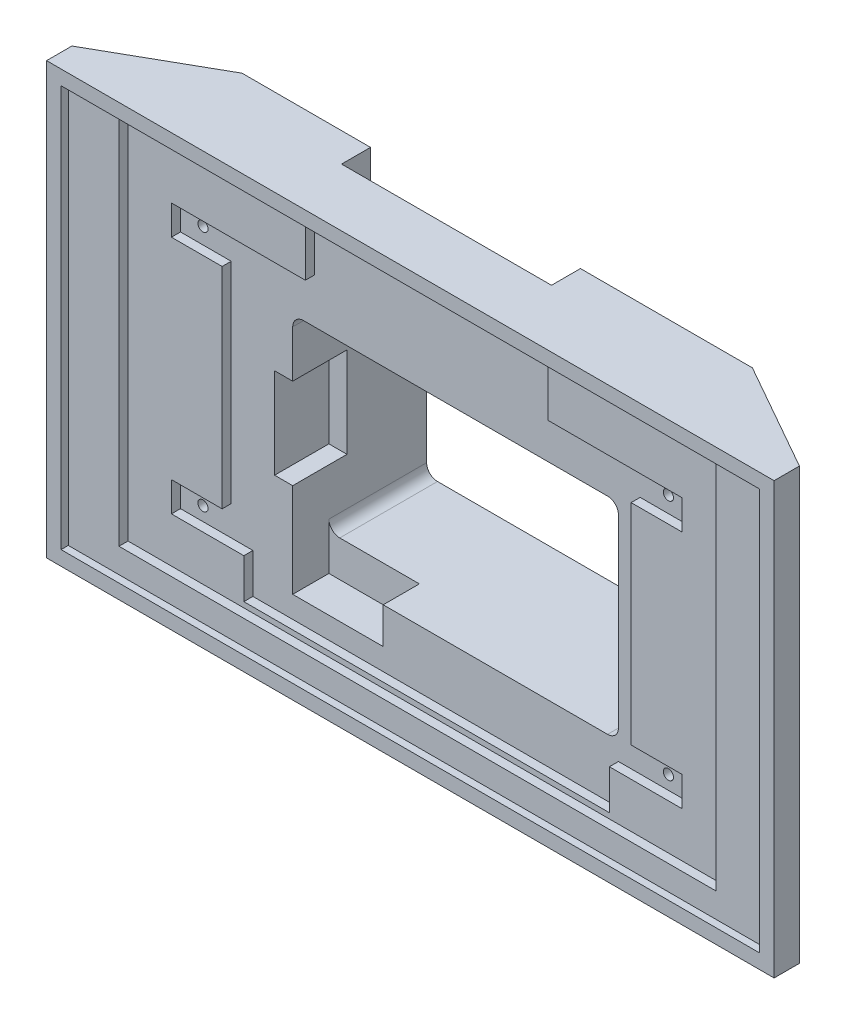
from build123d import *

# Parameters (mm, degrees)
SKETCH_1_W               = 201
SKETCH_1_H               = 119
SKETCH_1_W_2             = 193
SKETCH_1_H_2             = 111
EXTRUDE_1_DEPTH          = 7
SKETCH_2_W               = 193
SKETCH_2_H               = 111
SKETCH_2_W_2             = 165
SKETCH_2_H_2             = 103
EXTRUDE_2_DEPTH          = 5
EXTRUDE_3_DEPTH          = 2.5
LOFT_START               = -59.5
LOFT_1_DEPTH             = 119
LOFT_START_2             = -62
LOFT_1_2_OUTLINE_W       = 204
LOFT_1_2_OUTLINE_H       = 20
LOFT_1_2_DEPTH           = 3.262509478
SKETCH_6_W               = 90
SKETCH_6_H               = 57
CUT_EXTRUDE_1_DEPTH      = 119.023302788
SKETCH_7_W               = 100
SKETCH_7_H               = 67
SKETCH_7_W_2             = 90
SKETCH_7_H_2             = 57
EXTRUDE_4_DEPTH          = 20
CUT_EXTRUDE_2_DEPTH      = 123.513264592
CUT_EXTRUDE_2_DEPTH_BACK = 123.513264592
SKETCH_8_R               = 1.4
CHAMFER_1_SIZE           = 1.6
CHAMFER_1_SIZE2          = 1.2
SKETCH_9_W               = 25
SKETCH_9_H               = 10
CUT_EXTRUDE_3_DEPTH      = 10
SKETCH_11_W              = 5
SKETCH_11_H              = 25
CUT_EXTRUDE_4_DEPTH      = 15
SKETCH_12_W              = 16.5
SKETCH_12_H              = 16
SKETCH_12_W_2            = 15
SKETCH_12_H_2            = 18
CUT_EXTRUDE_5_DEPTH      = 25
SKETCH_13_R              = 3.5
SKETCH_13_W              = 10.5
SKETCH_13_H              = 4
SKETCH_13_W_2            = 8
CUT_EXTRUDE_6_DEPTH      = 137.913622409
SKETCH_14_W              = 58
SKETCH_14_H              = 8
CUT_EXTRUDE_7_DEPTH      = 28.7
SKETCH_16_W              = 16.5
SKETCH_16_H              = 2.9
EXTRUDE_5_DEPTH          = 1
FILLET_1_R               = 3
SKETCH_17_R              = 1.4
CUT_EXTRUDE_8_DEPTH      = 15


with BuildPart() as part:
    # 스케치1 → 보스-돌출1 (new body)
    with BuildSketch(Plane.XY):
        Rectangle(SKETCH_1_W, SKETCH_1_H)
        Rectangle(SKETCH_1_W_2, SKETCH_1_H_2, mode=Mode.SUBTRACT)
    extrude(amount=EXTRUDE_1_DEPTH)

    # 스케치2 → 보스-돌출2 (add)
    with BuildSketch(Plane.XY):
        Rectangle(SKETCH_2_W, SKETCH_2_H)
        with Locations((0, 2.8)):
            Rectangle(SKETCH_2_W_2, SKETCH_2_H_2, mode=Mode.SUBTRACT)
    extrude(amount=EXTRUDE_2_DEPTH)

    # 스케치3 → 보스-돌출3 (add)
    with BuildSketch(Plane.XY):
        Polygon((100.5, 59.5), (23.488425816, 59.5), (-23.488425816, 59.5), (-100.5, 59.5), (-100.5, -59.5), (-40.50450245, -59.5), (40.50450245, -59.5), (100.5, -59.5), align=None)
        Polygon((33.5, 54.3), (33.5, 38.2), (70.5, 38.2), (70.5, 30), (56.5, 30), (56.5, -28), (70.5, -28), (70.5, -36.2), (50.5, -36.2), (50.5, -47.2), (-50.5, -47.2), (-50.5, -36.2), (-70.5, -36.2), (-70.5, -28), (-56.5, -28), (-56.5, 30), (-70.5, 30), (-70.5, 38.2), (-33.5, 38.2), (-33.5, 54.3), align=None, mode=Mode.SUBTRACT)
    extrude(amount=EXTRUDE_3_DEPTH)

    # 로프트1: read off the stored shape, not the designer's step
    # 로프트1 outline → 로프트1 (add)
    with BuildSketch(Plane(origin=(0, 0, 0), x_dir=(1, 0, 0), z_dir=(0, 1, 0)).offset(LOFT_START)):
        Polygon((-100.5, 0), (100.5, 0), (70.5, 17), (-70.5, 17), align=None)
    extrude(amount=LOFT_1_DEPTH)

    # Loft 1 2 outline → Loft 1 2 (cut)
    with BuildSketch(Plane(origin=(0, 0, 0), x_dir=(1, 0, 0), z_dir=(0, 0.987184714663186, 0.15958176316661)).offset(LOFT_START_2)):
        with Locations((0, -1)):
            Rectangle(LOFT_1_2_OUTLINE_W, LOFT_1_2_OUTLINE_H)
    extrude(amount=LOFT_1_2_DEPTH, mode=Mode.SUBTRACT)

    # 스케치6 → 컷-돌출1 (cut, through all)
    with BuildSketch(Plane.XY):
        with Locations((5.5, -2.7)):
            Rectangle(SKETCH_6_W, SKETCH_6_H)
    extrude(amount=-CUT_EXTRUDE_1_DEPTH, mode=Mode.SUBTRACT)

    # 스케치7 → 보스-돌출4 (add)
    with BuildSketch(Plane(origin=(0, 0, -17), x_dir=(-1, 0, 0), z_dir=(0, 0, -1))):
        with Locations((-5.5, -2.7)):
            Rectangle(SKETCH_7_W, SKETCH_7_H)
        with Locations((-5.5, -2.7)):
            Rectangle(SKETCH_7_W_2, SKETCH_7_H_2, mode=Mode.SUBTRACT)
    extrude(amount=EXTRUDE_4_DEPTH)

    # 스케치8 → 컷-돌출2 (cut, two sides: drawn at the far end of the back side and taken through both)
    with BuildSketch(Plane.XY.offset(-CUT_EXTRUDE_2_DEPTH_BACK)):
        with Locations(Location((-64.298517718, 34.495358942, 0), (0, 0, 180))):
            Circle(SKETCH_8_R)
        with Locations(Location((-64.298517718, -32.379184814, 0), (0, 0, 180))):
            Circle(SKETCH_8_R)
        with Locations(Location((64.298517718, -32.379184814, 0), (0, 0, 180))):
            Circle(SKETCH_8_R)
        with Locations(Location((64.298517718, 34.495358942, 0), (0, 0, 180))):
            Circle(SKETCH_8_R)
    extrude(amount=CUT_EXTRUDE_2_DEPTH + CUT_EXTRUDE_2_DEPTH_BACK, mode=Mode.SUBTRACT)

    # 모따기1
    chamfer_1_edges = [part.edges().sort_by_distance(p)[0] for p in [
        (65.698517718, 34.495358942, -17),
        (65.698517718, -32.379184814, -17),
        (-62.898517718, -32.379184814, -17),
        (-62.898517718, 34.495358942, -17),
    ]]
    chamfer_1_side = [part.faces().sort_by_distance(p)[0] for p in [
        (0, -54.924448604, -17),
    ]]
    chamfer(chamfer_1_edges, length=CHAMFER_1_SIZE, length2=CHAMFER_1_SIZE2, reference=chamfer_1_side[0])

    # 스케치9 → 컷-돌출3 (cut)
    with BuildSketch(Plane.XY):
        with Locations((-27, -36.2)):
            Rectangle(SKETCH_9_W, SKETCH_9_H)
    extrude(amount=-CUT_EXTRUDE_3_DEPTH, mode=Mode.SUBTRACT)

    # 스케치11 → 컷-돌출4 (cut)
    with BuildSketch(Plane.XY):
        with Locations((-42, -2.7)):
            Rectangle(SKETCH_11_W, SKETCH_11_H)
    extrude(amount=-CUT_EXTRUDE_4_DEPTH, mode=Mode.SUBTRACT)

    # 스케치12 → 컷-돌출5 (cut)
    with BuildSketch(Plane.ZY.offset(-50.5)):
        with Locations((-22.75, 15.000577725)):
            Rectangle(SKETCH_12_W, SKETCH_12_H)
        with Locations((-22.75, -2.499422275)):
            Rectangle(SKETCH_12_W, SKETCH_12_H)
        with Locations((-22, -20.999422275)):
            Rectangle(SKETCH_12_W_2, SKETCH_12_H_2)
    extrude(amount=-CUT_EXTRUDE_5_DEPTH, mode=Mode.SUBTRACT)

    # 스케치13 → 컷-돌출6 (cut, through all)
    with BuildSketch(Plane.XZ.offset(-25.8)):
        with Locations(Location((16.152845052, -14.5, 0), (0, 0, 270))):
            Circle(SKETCH_13_R)
        with Locations((-27.097154948, -13)):
            Rectangle(SKETCH_13_W, SKETCH_13_H)
        with Locations((-11.847154948, -13)):
            Rectangle(SKETCH_13_W_2, SKETCH_13_H)
        with Locations((2.152845052, -13)):
            Rectangle(SKETCH_13_W_2, SKETCH_13_H)
    extrude(amount=-CUT_EXTRUDE_6_DEPTH, mode=Mode.SUBTRACT)

    # 스케치14 → 컷-돌출7 (cut)
    with BuildSketch(Plane(origin=(0, 59.5, 0), x_dir=(1, 0, 0), z_dir=(0, 1, 0))):
        with Locations((-6, 13)):
            Rectangle(SKETCH_14_W, SKETCH_14_H)
    extrude(amount=-CUT_EXTRUDE_7_DEPTH, mode=Mode.SUBTRACT)

    # 스케치16 → 보스-돌출5 (add)
    with BuildSketch(Plane(origin=(55.5, 0, 0), x_dir=(0, 0, -1), z_dir=(1, 0, 0))):
        with Locations((22.75, 6.250577725)):
            Rectangle(SKETCH_16_W, SKETCH_16_H)
        with Locations((22.75, -11.249422275)):
            Rectangle(SKETCH_16_W, SKETCH_16_H)
    extrude(amount=-EXTRUDE_5_DEPTH)

    # 필렛1
    # the kernel refuses this fillet: 3 mm, written as the material it adds along each edge
    with BuildSketch(Plane(origin=(50.5, -31.2, 0), x_dir=(0, 1, 0), z_dir=(0, 0, -1))) as fillet_1_piece_1_section:
        with BuildLine():
            CenterArc((FILLET_1_R, -FILLET_1_R), FILLET_1_R, 90, 90)
            Line((0, -FILLET_1_R), (0, 0))
            Line((0, 0), (FILLET_1_R, 0))
        make_face()
    fillet_1_piece_1 = extrude(amount=37, mode=Mode.PRIVATE)
    fillet_1_piece_1 = split(fillet_1_piece_1, bisect_by=Plane(origin=(50.5, -29.999422275, 0), z_dir=(0, 1, 0)), keep=Keep.TOP, mode=Mode.PRIVATE)
    fillet_1_piece_1 = split(fillet_1_piece_1, bisect_by=Plane(origin=(50.5, -31.2, -14.5), z_dir=(0, 0, 1)), keep=Keep.TOP, mode=Mode.PRIVATE)
    add(fillet_1_piece_1)
    with BuildSketch(Plane(origin=(50.5, -31.2, 0), x_dir=(0, 1, 0), z_dir=(0, 0, -1))) as fillet_1_piece_2_section:
        with BuildLine():
            CenterArc((FILLET_1_R, -FILLET_1_R), FILLET_1_R, 90, 90)
            Line((0, -FILLET_1_R), (0, 0))
            Line((0, 0), (FILLET_1_R, 0))
        make_face()
    fillet_1_piece_2 = extrude(amount=37, mode=Mode.PRIVATE)
    fillet_1_piece_2 = split(fillet_1_piece_2, bisect_by=Plane(origin=(50.5, -29.999422275, 0), z_dir=(0, -1, 0)), keep=Keep.TOP, mode=Mode.PRIVATE)
    fillet_1_piece_2 = split(fillet_1_piece_2, bisect_by=Plane(origin=(50.5, -31.2, -14.5), z_dir=(0, 0, 1)), keep=Keep.TOP, mode=Mode.PRIVATE)
    add(fillet_1_piece_2)
    with BuildSketch(Plane(origin=(50.5, -31.2, 0), x_dir=(0, 1, 0), z_dir=(0, 0, -1))) as fillet_1_piece_3_section:
        with BuildLine():
            CenterArc((FILLET_1_R, -FILLET_1_R), FILLET_1_R, 90, 90)
            Line((0, -FILLET_1_R), (0, 0))
            Line((0, 0), (FILLET_1_R, 0))
        make_face()
    fillet_1_piece_3 = extrude(amount=37, mode=Mode.PRIVATE)
    fillet_1_piece_3 = split(fillet_1_piece_3, bisect_by=Plane(origin=(50.5, -29.999422275, 0), z_dir=(0, -1, 0)), keep=Keep.TOP, mode=Mode.PRIVATE)
    fillet_1_piece_3 = split(fillet_1_piece_3, bisect_by=Plane(origin=(50.5, -31.2, -29.5), z_dir=(0, 0, 1)), keep=Keep.TOP, mode=Mode.PRIVATE)
    fillet_1_piece_3 = split(fillet_1_piece_3, bisect_by=Plane(origin=(50.5, -31.2, -14.5), z_dir=(0, 0, -1)), keep=Keep.TOP, mode=Mode.PRIVATE)
    add(fillet_1_piece_3)
    with BuildSketch(Plane(origin=(50.5, -31.2, 0), x_dir=(0, 1, 0), z_dir=(0, 0, -1))) as fillet_1_piece_4_section:
        with BuildLine():
            CenterArc((FILLET_1_R, -FILLET_1_R), FILLET_1_R, 90, 90)
            Line((0, -FILLET_1_R), (0, 0))
            Line((0, 0), (FILLET_1_R, 0))
        make_face()
    fillet_1_piece_4 = extrude(amount=37, mode=Mode.PRIVATE)
    fillet_1_piece_4 = split(fillet_1_piece_4, bisect_by=Plane(origin=(50.5, -29.999422275, 0), z_dir=(0, 1, 0)), keep=Keep.TOP, mode=Mode.PRIVATE)
    fillet_1_piece_4 = split(fillet_1_piece_4, bisect_by=Plane(origin=(50.5, -31.2, -29.5), z_dir=(0, 0, -1)), keep=Keep.TOP, mode=Mode.PRIVATE)
    add(fillet_1_piece_4)
    with BuildSketch(Plane(origin=(50.5, -31.2, 0), x_dir=(0, 1, 0), z_dir=(0, 0, -1))) as fillet_1_piece_5_section:
        with BuildLine():
            CenterArc((FILLET_1_R, -FILLET_1_R), FILLET_1_R, 90, 90)
            Line((0, -FILLET_1_R), (0, 0))
            Line((0, 0), (FILLET_1_R, 0))
        make_face()
    fillet_1_piece_5 = extrude(amount=37, mode=Mode.PRIVATE)
    fillet_1_piece_5 = split(fillet_1_piece_5, bisect_by=Plane(origin=(50.5, -29.999422275, 0), z_dir=(0, -1, 0)), keep=Keep.TOP, mode=Mode.PRIVATE)
    fillet_1_piece_5 = split(fillet_1_piece_5, bisect_by=Plane(origin=(50.5, -31.2, -29.5), z_dir=(0, 0, -1)), keep=Keep.TOP, mode=Mode.PRIVATE)
    add(fillet_1_piece_5)
    with BuildSketch(Plane(origin=(50.5, 25.8, -37), x_dir=(0, -1, 0), z_dir=(0, 0, 1))) as fillet_1_piece_6_section:
        with BuildLine():
            CenterArc((FILLET_1_R, -FILLET_1_R), FILLET_1_R, 90, 90)
            Line((0, -FILLET_1_R), (0, 0))
            Line((0, 0), (FILLET_1_R, 0))
        make_face()
    fillet_1_piece_6 = extrude(amount=37, mode=Mode.PRIVATE)
    fillet_1_piece_6 = split(fillet_1_piece_6, bisect_by=Plane(origin=(50.5, 23.000577725, -37), z_dir=(0, -1, 0)), keep=Keep.TOP, mode=Mode.PRIVATE)
    fillet_1_piece_6 = split(fillet_1_piece_6, bisect_by=Plane(origin=(50.5, 25.8, -31), z_dir=(0, 0, -1)), keep=Keep.TOP, mode=Mode.PRIVATE)
    add(fillet_1_piece_6)
    with BuildSketch(Plane(origin=(50.5, 25.8, -37), x_dir=(0, -1, 0), z_dir=(0, 0, 1))) as fillet_1_piece_7_section:
        with BuildLine():
            CenterArc((FILLET_1_R, -FILLET_1_R), FILLET_1_R, 90, 90)
            Line((0, -FILLET_1_R), (0, 0))
            Line((0, 0), (FILLET_1_R, 0))
        make_face()
    fillet_1_piece_7 = extrude(amount=37, mode=Mode.PRIVATE)
    fillet_1_piece_7 = split(fillet_1_piece_7, bisect_by=Plane(origin=(50.5, 23.000577725, -37), z_dir=(0, 1, 0)), keep=Keep.TOP, mode=Mode.PRIVATE)
    fillet_1_piece_7 = split(fillet_1_piece_7, bisect_by=Plane(origin=(50.5, 25.8, -31), z_dir=(0, 0, -1)), keep=Keep.TOP, mode=Mode.PRIVATE)
    add(fillet_1_piece_7)
    with BuildSketch(Plane(origin=(50.5, 25.8, -37), x_dir=(0, -1, 0), z_dir=(0, 0, 1))) as fillet_1_piece_8_section:
        with BuildLine():
            CenterArc((FILLET_1_R, -FILLET_1_R), FILLET_1_R, 90, 90)
            Line((0, -FILLET_1_R), (0, 0))
            Line((0, 0), (FILLET_1_R, 0))
        make_face()
    fillet_1_piece_8 = extrude(amount=37, mode=Mode.PRIVATE)
    fillet_1_piece_8 = split(fillet_1_piece_8, bisect_by=Plane(origin=(50.5, 23.000577725, -37), z_dir=(0, 1, 0)), keep=Keep.TOP, mode=Mode.PRIVATE)
    fillet_1_piece_8 = split(fillet_1_piece_8, bisect_by=Plane(origin=(50.5, 25.8, -31), z_dir=(0, 0, 1)), keep=Keep.TOP, mode=Mode.PRIVATE)
    fillet_1_piece_8 = split(fillet_1_piece_8, bisect_by=Plane(origin=(50.5, 25.8, -14.5), z_dir=(0, 0, -1)), keep=Keep.TOP, mode=Mode.PRIVATE)
    add(fillet_1_piece_8)
    with BuildSketch(Plane(origin=(50.5, 25.8, -37), x_dir=(0, -1, 0), z_dir=(0, 0, 1))) as fillet_1_piece_9_section:
        with BuildLine():
            CenterArc((FILLET_1_R, -FILLET_1_R), FILLET_1_R, 90, 90)
            Line((0, -FILLET_1_R), (0, 0))
            Line((0, 0), (FILLET_1_R, 0))
        make_face()
    fillet_1_piece_9 = extrude(amount=37, mode=Mode.PRIVATE)
    fillet_1_piece_9 = split(fillet_1_piece_9, bisect_by=Plane(origin=(50.5, 23.000577725, -37), z_dir=(0, -1, 0)), keep=Keep.TOP, mode=Mode.PRIVATE)
    fillet_1_piece_9 = split(fillet_1_piece_9, bisect_by=Plane(origin=(50.5, 25.8, -14.5), z_dir=(0, 0, 1)), keep=Keep.TOP, mode=Mode.PRIVATE)
    add(fillet_1_piece_9)
    with BuildSketch(Plane(origin=(50.5, 25.8, -37), x_dir=(0, -1, 0), z_dir=(0, 0, 1))) as fillet_1_piece_10_section:
        with BuildLine():
            CenterArc((FILLET_1_R, -FILLET_1_R), FILLET_1_R, 90, 90)
            Line((0, -FILLET_1_R), (0, 0))
            Line((0, 0), (FILLET_1_R, 0))
        make_face()
    fillet_1_piece_10 = extrude(amount=37, mode=Mode.PRIVATE)
    fillet_1_piece_10 = split(fillet_1_piece_10, bisect_by=Plane(origin=(50.5, 23.000577725, -37), z_dir=(0, 1, 0)), keep=Keep.TOP, mode=Mode.PRIVATE)
    fillet_1_piece_10 = split(fillet_1_piece_10, bisect_by=Plane(origin=(50.5, 25.8, -14.5), z_dir=(0, 0, 1)), keep=Keep.TOP, mode=Mode.PRIVATE)
    add(fillet_1_piece_10)
    with BuildSketch(Plane(origin=(-39.5, -31.2, -10), x_dir=(0, 1, 0), z_dir=(0, 0, -1))) as fillet_1_piece_11:
        with BuildLine():
            CenterArc((FILLET_1_R, FILLET_1_R), FILLET_1_R, 180, 90)
            Line((0, FILLET_1_R), (0, 0))
            Line((0, 0), (FILLET_1_R, 0))
        make_face()
    extrude(amount=27)
    with BuildSketch(Plane(origin=(-39.5, 25.8, 0), x_dir=(1, 0, 0), z_dir=(0, 0, -1))) as fillet_1_piece_12:
        with BuildLine():
            CenterArc((FILLET_1_R, FILLET_1_R), FILLET_1_R, 180, 90)
            Line((0, FILLET_1_R), (0, 0))
            Line((0, 0), (FILLET_1_R, 0))
        make_face()
    extrude(amount=37)
    # the kernel refuses this fillet: 3 mm, written as the material it takes off along each edge
    with BuildSketch(Plane(origin=(-44.5, -36.2, -17), x_dir=(1, 0, 0), z_dir=(0, 0, -1)), Plane(origin=(55.5, -36.2, -17), x_dir=(0, 1, 0), z_dir=(0, 0, -1)), Plane(origin=(-44.5, 30.8, -17), x_dir=(0, -1, 0), z_dir=(0, 0, -1))) as fillet_1_2_piece_1:
        with BuildLine():
            CenterArc((FILLET_1_R, -FILLET_1_R), FILLET_1_R, 90, 90)
            Line((0, -FILLET_1_R), (0, 0))
            Line((0, 0), (FILLET_1_R, 0))
        make_face()
    extrude(amount=27.5, mode=Mode.SUBTRACT)
    with BuildSketch(Plane(origin=(55.5, 30.8, -17), x_dir=(0, -1, 0), z_dir=(0, 0, -1))) as fillet_1_2_piece_2:
        with BuildLine():
            CenterArc((FILLET_1_R, FILLET_1_R), FILLET_1_R, 180, 90)
            Line((0, FILLET_1_R), (0, 0))
            Line((0, 0), (FILLET_1_R, 0))
        make_face()
    extrude(amount=27.5, mode=Mode.SUBTRACT)

    # 스케치17 → 컷-돌출8 (cut)
    with BuildSketch(Plane(origin=(0, 0, -37), x_dir=(-1, 0, 0), z_dir=(0, 0, -1))):
        with Locations((-52.5, -33.2)):
            Circle(SKETCH_17_R)
        with Locations(Location((41.533478294, -32.122994894, 0), (0, 0, 180))):
            Circle(SKETCH_17_R)
        with Locations((41.533478294, 26.722994894)):
            Circle(SKETCH_17_R)
        with Locations(Location((-52.5, 27.8, 0), (0, 0, 180))):
            Circle(SKETCH_17_R)
    extrude(amount=-CUT_EXTRUDE_8_DEPTH, mode=Mode.SUBTRACT)


solid = part.part
